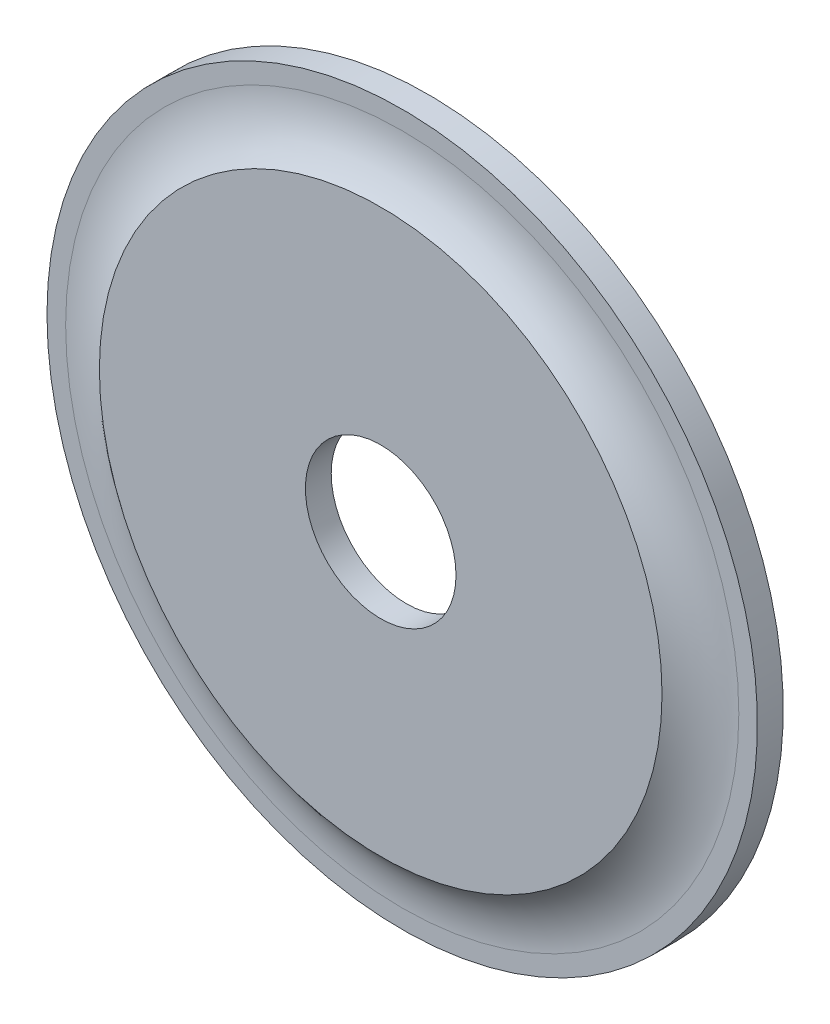
from build123d import *

# Parameters (mm, degrees)
SKETCH1_R           = 3.25
SKETCH1_R_2         = 0.875
BOSS_EXTRUDE1_DEPTH = 0.25
SKETCH2_R           = 4.078298916
BOSS_EXTRUDE2_DEPTH = 0.25
FILLET1_R           = 1
SHELL1_T            = 0.05
CUT_EXTRUDE1_START  = -2.25
SKETCH3_R           = 0.875
CUT_EXTRUDE1_DEPTH  = 2.25
BOSS_EXTRUDE3_START = 0.25
SKETCH4_R           = 1.213418459
SKETCH4_R_2         = 0.875
BOSS_EXTRUDE3_DEPTH = 0.25
CHAMFER1_SIZE       = 0.2


with BuildPart() as part:
    # Sketch1 → Boss-Extrude1 (new body)
    with BuildSketch(Plane.XY):
        Circle(SKETCH1_R)
        Circle(SKETCH1_R_2, mode=Mode.SUBTRACT)
    extrude(amount=BOSS_EXTRUDE1_DEPTH)

    # Sketch2 → Boss-Extrude2 (add)
    with BuildSketch(Plane(origin=(0, 0, 0), x_dir=(-1, 0, 0), z_dir=(0, 0, -1))):
        Circle(SKETCH2_R)
    extrude(amount=BOSS_EXTRUDE2_DEPTH)

    # Fillet1
    # the kernel refuses this fillet: 1 mm, written as the material it adds along each edge
    with BuildSketch(Plane(origin=(0, 0, 0), x_dir=(1, 0, 0), z_dir=(0, -1, 0))) as fillet1_piece_1:
        with BuildLine():
            CenterArc((3.911437828, 1), FILLET1_R, 228.590377891, 41.409622109)
            Line((3.25, 0.25), (3.25, 0))
            Line((3.25, 0), (3.911437828, 0))
        make_face()
    revolve(axis=Axis((0, 0, 0), (0, 0, 1)))

    # Shell1
    shell1_openings = [part.faces().sort_by_distance(p)[0] for p in [
        (0, 0, -0.25),
    ]]
    offset(amount=SHELL1_T, openings=shell1_openings, kind=Kind.INTERSECTION)

    # Sketch3 → Cut-Extrude1 (cut)
    with BuildSketch(Plane.XY.offset(0.3).offset(CUT_EXTRUDE1_START)):
        Circle(SKETCH3_R)
    extrude(amount=CUT_EXTRUDE1_DEPTH, mode=Mode.SUBTRACT)

    # Sketch4 → Boss-Extrude3 (add)
    with BuildSketch(Plane(origin=(0, 0, 0.25), x_dir=(-1, 0, 0), z_dir=(0, 0, -1)).offset(BOSS_EXTRUDE3_START)):
        with Locations(Location((0, 0, 0), (0, 0, 180))):
            Circle(SKETCH4_R)
        with Locations(Location((0, 0, 0), (0, 0, 180))):
            Circle(SKETCH4_R_2, mode=Mode.SUBTRACT)
    extrude(amount=-BOSS_EXTRUDE3_DEPTH)

    # Chamfer1
    chamfer1_edges = [part.edges().sort_by_distance(p)[0] for p in [
        (-1.213418459, 0, 0),
    ]]
    chamfer(chamfer1_edges, length=CHAMFER1_SIZE)


solid = part.part
